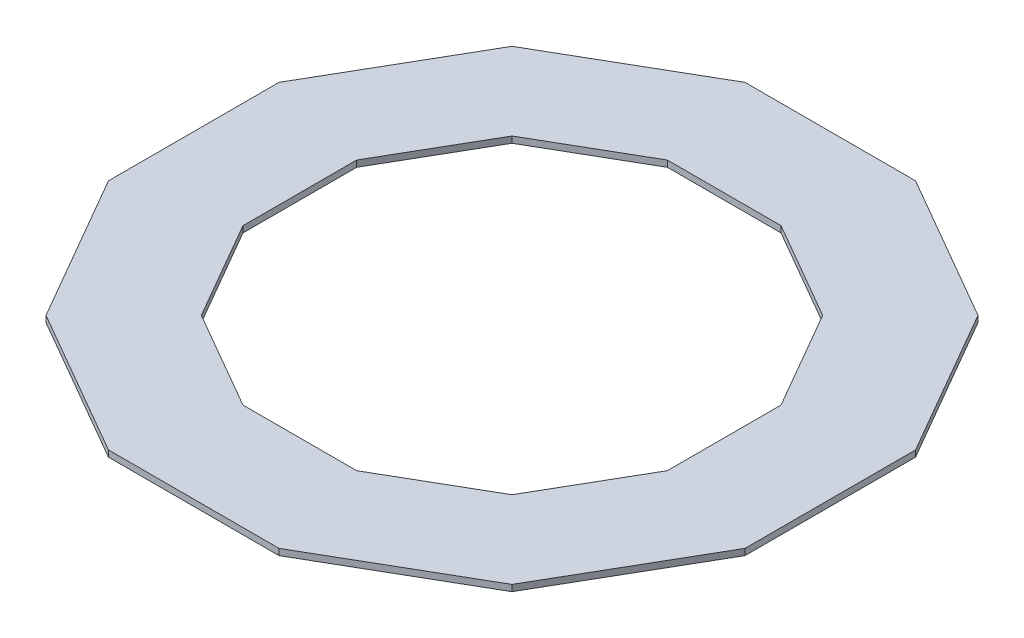
from build123d import *

# Parameters (mm, degrees)
BOSS_EXTRUDE1_DEPTH = 2.921
CUT_EXTRUDE1_DEPTH  = 209.202762766


with BuildPart() as part:
    # Sketch1 → Boss-Extrude1 (new body)
    with BuildSketch(Plane(origin=(0, 0, 0), x_dir=(1, 0, 0), z_dir=(0, 1, 0))):
        Polygon((107.763073453, 107.763073453), (39.444022474, 147.207095926), (-39.444022474, 147.207095926), (-107.763073453, 107.763073453), (-147.207095926, 39.444022474), (-147.207095926, -39.444022474), (-107.763073453, -107.763073453), (-39.444022474, -147.207095926), (39.444022474, -147.207095926), (107.763073453, -107.763073453), (147.207095926, -39.444022474), (147.207095926, 39.444022474), align=None)
    extrude(amount=-BOSS_EXTRUDE1_DEPTH)

    # Sketch3 → Cut-Extrude1 (cut, through all)
    with BuildSketch(Plane(origin=(0, 0, 0), x_dir=(1, 0, 0), z_dir=(0, 1, 0))):
        Polygon((-26.296014982, 98.138063951), (-71.842048969, 71.842048969), (-98.138063951, 26.296014982), (-98.138063951, -26.296014982), (-71.842048969, -71.842048969), (-26.296014982, -98.138063951), (26.296014982, -98.138063951), (71.842048969, -71.842048969), (98.138063951, -26.296014982), (98.138063951, 26.296014982), (71.842048969, 71.842048969), (26.296014982, 98.138063951), align=None)
    extrude(amount=-CUT_EXTRUDE1_DEPTH, mode=Mode.SUBTRACT)


solid = part.part
